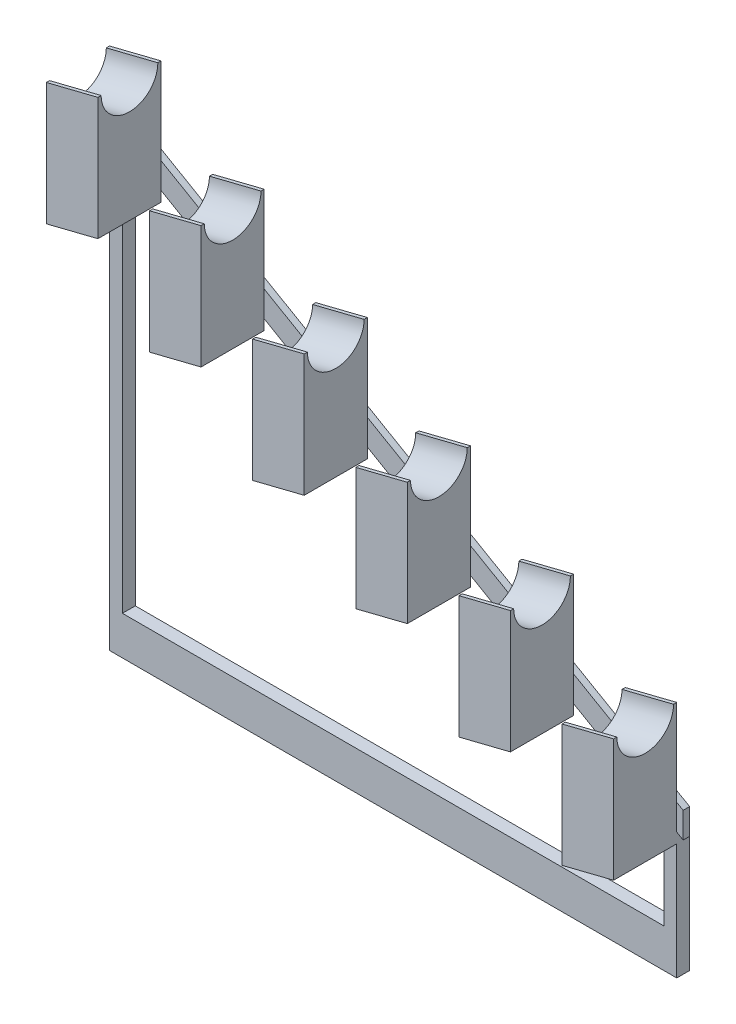
from build123d import *

# Parameters (mm, degrees)
BOSS_EXTRUDE1_START = -49
BOSS_EXTRUDE1_DEPTH = 5
LPATTERN1_COUNT     = 6
LPATTERN1_PITCH     = 92.4
BOSS_EXTRUDE2_START = -15
SKETCH8_W           = 10
SKETCH8_H           = 10
BOSS_EXTRUDE2_DEPTH = 330
BOSS_EXTRUDE5_REACH = 540.346
SKETCH11_W          = 10
SKETCH11_H          = 10
FILLET1_R           = 20
SKETCH12_W          = 440.103736548
SKETCH12_H          = 30
BOSS_EXTRUDE6_DEPTH = 10


with BuildPart() as part:
    # Sweep1: sweep along a path in Sketch3
    with BuildLine(Plane.XY) as sweep1_path:
        Line((0, 0), (-40, -10))
    # Sketch2 → Sweep1 (sweep)
    with BuildSketch(Plane(origin=(0, 0, 0), x_dir=(0, 0, -1), z_dir=(1, 0, 0))):
        with BuildLine():
            Line((-24.5, 0), (-22, 0))
            ThreePointArc((-22, 0), (0, -22), (22, 0))
            Line((22, 0), (24.5, 0))
            Line((24.5, 0), (24.5, -95))
            Line((24.5, -95), (-24.5, -95))
            Line((-24.5, -95), (-24.5, 0))
        make_face()
    sweep1 = sweep(path=sweep1_path.line)

    # Sketch7 → Boss-Extrude1 (add)
    with BuildSketch(Plane.XY.offset(24.5).offset(BOSS_EXTRUDE1_START)):
        Polygon((5, -70), (-445, 189.807621135), (-445, 169.807621135), (5, -90), align=None)
    extrude(amount=-BOSS_EXTRUDE1_DEPTH)

    # LPattern1: Sweep1 ×6
    with Locations(*[Vector(-0.86602540378444, 0.4999999999999978, 0) * (i * LPATTERN1_PITCH) for i in range(1, LPATTERN1_COUNT)]):
        add(sweep1)

    # Sketch8 → Boss-Extrude2 (add)
    with BuildSketch(Plane(origin=(0, 189.807621135, 0), x_dir=(1, 0, 0), z_dir=(0, 1, 0)).offset(BOSS_EXTRUDE2_START)):
        with Locations((-435.103736548, 29.5)):
            Rectangle(SKETCH8_W, SKETCH8_H)
    extrude(amount=-BOSS_EXTRUDE2_DEPTH)

    # Boss-Extrude5: up to this face of the body (flat: up to its plane)
    boss_extrude5_end = Plane(part.part.faces().sort_by_distance((-435.103736548, -155.192378865, -29.5))[0])
    # Sketch11 → Boss-Extrude5 (add, up to the picked face)
    with BuildSketch(Plane(origin=(0, -70, 0), x_dir=(1, 0, 0), z_dir=(0, 1, 0)), mode=Mode.PRIVATE) as boss_extrude5_sk1:
        with Locations((-5, 29.5)):
            Rectangle(SKETCH11_W, SKETCH11_H)
    boss_extrude5_tool1 = split(extrude(boss_extrude5_sk1.sketch, amount=-BOSS_EXTRUDE5_REACH, mode=Mode.PRIVATE), bisect_by=boss_extrude5_end, keep=Keep.BOTH, mode=Mode.PRIVATE)
    add(boss_extrude5_tool1.solids().sort_by(Axis((-5, -70, -29.5), (0, -1, 0)))[0])

    # Fillet1
    # the kernel refuses this fillet: 20 mm, written as the material it takes off along each edge
    with BuildSketch(Plane(origin=(-43.071891388, -70, -34.5), x_dir=(0, -1, 0), z_dir=(1, 0, 0))) as fillet1_piece_1:
        with BuildLine():
            CenterArc((13.228756555, -20), FILLET1_R, 90, 41.409622109)
            Line((0, -5), (-0.264575131, -4.7))
            ThreePointArc((-0.264575131, -4.7), (-0.4, -2.5), (-0.4, 0))
            Line((-0.4, 0), (0, 0.4))
            Line((0, 0.4), (13.228756555, 0.4))
            Line((13.228756555, 0.4), (13.228756555, 0))
        make_face()
    extrude(amount=76.143782777, mode=Mode.SUBTRACT)
    with BuildSketch(Plane(origin=(-397.03184516, 174.807621135, -34.5), x_dir=(0, -1, 0), z_dir=(-1, 0, 0))) as fillet1_piece_2:
        with BuildLine():
            CenterArc((13.228756555, 20), FILLET1_R, 228.590377891, 41.409622109)
            Line((0, 5), (-0.264575131, 4.7))
            ThreePointArc((-0.264575131, 4.7), (-0.4, 2.5), (-0.4, 0))
            Line((-0.4, 0), (0, -0.4))
            Line((0, -0.4), (13.228756555, -0.4))
            Line((13.228756555, -0.4), (13.228756555, 0))
        make_face()
    extrude(amount=76.143782777, mode=Mode.SUBTRACT)

    # Sketch12 → Boss-Extrude6 (add)
    with BuildSketch(Plane(origin=(0, 0, -34.5), x_dir=(-1, 0, 0), z_dir=(0, 0, -1))):
        with Locations((220.051868274, -170.192378865)):
            Rectangle(SKETCH12_W, SKETCH12_H)
    extrude(amount=-BOSS_EXTRUDE6_DEPTH)


solid = part.part
